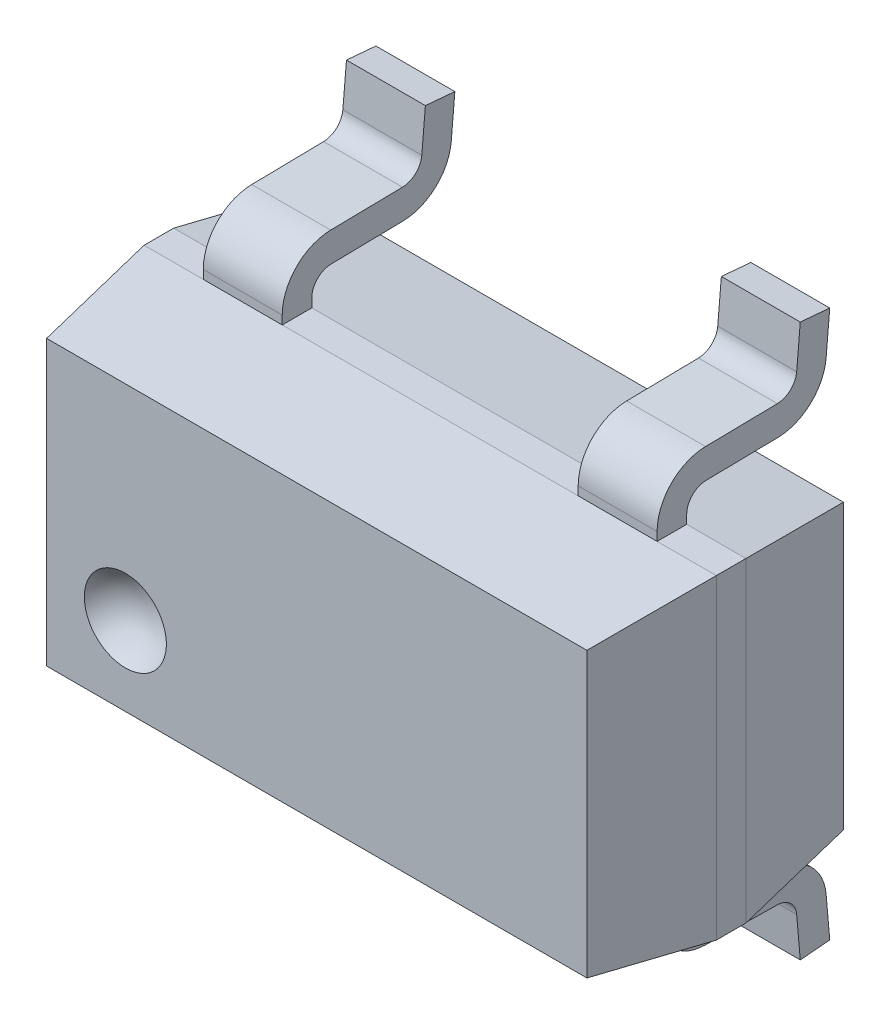
from build123d import *
from OCP.BRepFilletAPI import BRepFilletAPI_MakeChamfer
from build123d.topology import SkipClean

# Parameters (mm, degrees)
BODYWXH_W             = 1.3
BODYWXH_H             = 1.6
BOSS_BODY_DEPTH       = 1.45
CHAMFER1_SIZE         = 0.575
CHAMFER1_SIZE2        = 0.08081098
PINS_DEPTH            = 0.4
PATTERNLEADS_COUNT    = 3
PATTERNLEADS_PITCH    = 0.95
DELETEFACE1_START     = 0.8
DELETEFACE1_OUTLINE_W = 0.4
DELETEFACE1_OUTLINE_H = 1.875
DELETEFACE1_DEPTH     = 0.6


# Read off the part's stored shape, not the designer's step: DeleteFace1
with BuildPart() as part:
    # BodyWxH → Boss-Body (new, symmetric)
    with BuildSketch(Plane(origin=(0, 0, 0), x_dir=(0, 0, -1), z_dir=(1, 0, 0))):
        with Locations((-0.8, 0)):
            Rectangle(BODYWXH_W, BODYWXH_H)
    extrude(amount=BOSS_BODY_DEPTH, both=True)

    # Chamfer1: one chamfer whose edges measure the first distance from different faces: ONE call of the kernel's chamfer builder (chamfer() names one face for all edges)
    chamfer1_edges_1 = [part.edges().sort_by_distance(p)[0] for p in [
        (1.45, 0, 0.15),
        (1.45, 0, 1.45),
    ]]
    chamfer1_side_1 = [part.faces().sort_by_distance(p)[0] for p in [
        (1.45, 0, 0.8),
    ]]
    chamfer1_edges_2 = [part.edges().sort_by_distance(p)[0] for p in [
        (-1.45, 0, 0.15),
        (-1.45, 0, 1.45),
    ]]
    chamfer1_side_2 = [part.faces().sort_by_distance(p)[0] for p in [
        (-1.45, 0, 0.8),
    ]]
    chamfer1_edges_3 = [part.edges().sort_by_distance(p)[0] for p in [
        (0, 0.8, 1.45),
        (0, 0.8, 0.15),
    ]]
    chamfer1_side_3 = [part.faces().sort_by_distance(p)[0] for p in [
        (0, 0.8, 0.8),
    ]]
    chamfer1_edges_4 = [part.edges().sort_by_distance(p)[0] for p in [
        (0, -0.8, 0.15),
        (0, -0.8, 1.45),
    ]]
    chamfer1_side_4 = [part.faces().sort_by_distance(p)[0] for p in [
        (0, -0.8, 0.8),
    ]]
    chamfer1 = BRepFilletAPI_MakeChamfer(part.part.solid().wrapped)
    for e in chamfer1_edges_1:
        chamfer1.Add(CHAMFER1_SIZE, CHAMFER1_SIZE2, e.wrapped, chamfer1_side_1[0].wrapped)  # the first distance lies on this face
    for e in chamfer1_edges_2:
        chamfer1.Add(CHAMFER1_SIZE, CHAMFER1_SIZE2, e.wrapped, chamfer1_side_2[0].wrapped)  # the first distance lies on this face
    for e in chamfer1_edges_3:
        chamfer1.Add(CHAMFER1_SIZE, CHAMFER1_SIZE2, e.wrapped, chamfer1_side_3[0].wrapped)  # the first distance lies on this face
    for e in chamfer1_edges_4:
        chamfer1.Add(CHAMFER1_SIZE, CHAMFER1_SIZE2, e.wrapped, chamfer1_side_4[0].wrapped)  # the first distance lies on this face
    add(Compound.cast(chamfer1.Shape()), mode=Mode.REPLACE)

    # LeadCross → Pins (add)
    with BuildSketch(Plane(origin=(-1.15, 0, 0), x_dir=(0, 0, -1), z_dir=(1, 0, 0))):
        with BuildLine():
            Line((0, -1.386926639), (-0.149429205, -1.4))
            Line((-0.149429205, -1.4), (-0.167692783, -1.19124635))
            ThreePointArc((-0.167692783, -1.19124635), (-0.199112416, -1.126826554), (-0.265567012, -1.099977154))
            Line((-0.265567012, -1.099977154), (-0.629363102, -1.09362707))
            ThreePointArc((-0.629363102, -1.09362707), (-0.803312612, -1.018892462), (-0.875, -0.843665146))
            Line((-0.875, -0.843665146), (-0.875, 0.843665146))
            ThreePointArc((-0.875, 0.843665146), (-0.803312612, 1.018892462), (-0.629363102, 1.09362707))
            Line((-0.629363102, 1.09362707), (-0.265567012, 1.099977154))
            ThreePointArc((-0.265567012, 1.099977154), (-0.199112416, 1.126826554), (-0.167692783, 1.19124635))
            Line((-0.167692783, 1.19124635), (-0.149429205, 1.4))
            Line((-0.149429205, 1.4), (0, 1.386926639))
            Line((0, 1.386926639), (-0.018263578, 1.178172988))
            ThreePointArc((-0.018263578, 1.178172988), (-0.096812662, 1.017123498), (-0.262949151, 0.95))
            Line((-0.262949151, 0.95), (-0.626745241, 0.943649916))
            ThreePointArc((-0.626745241, 0.943649916), (-0.696325045, 0.913756073), (-0.725, 0.843665146))
            Line((-0.725, 0.843665146), (-0.725, -0.843665146))
            ThreePointArc((-0.725, -0.843665146), (-0.696325045, -0.913756073), (-0.626745241, -0.943649916))
            Line((-0.626745241, -0.943649916), (-0.262949151, -0.95))
            ThreePointArc((-0.262949151, -0.95), (-0.096812662, -1.017123498), (-0.018263578, -1.178172988))
            Line((-0.018263578, -1.178172988), (0, -1.386926639))
        make_face()
    pins = extrude(amount=PINS_DEPTH)

    # PatternLeads: Pins ×3
    with Locations(*[(i * PATTERNLEADS_PITCH, 0, 0) for i in range(1, PATTERNLEADS_COUNT)]):
        add(pins)

    # Pin1Indent → Cut-Pin1Indent (revolve, cut)
    with SkipClean():  # the faces are left unmerged after this step: merging them gives an invalid solid
        with BuildSketch(Plane(origin=(-0.97, 0, 0), x_dir=(0, 0, -1), z_dir=(1, 0, 0))):
            with BuildLine():
                Line((-1.57, -0.08), (-1.57, -0.56))
                ThreePointArc((-1.57, -0.56), (-1.33, -0.32), (-1.57, -0.08))
            make_face()
        revolve(axis=Axis((-0.97, -0.08, 1.57), (0, -1, 0)), mode=Mode.SUBTRACT)

    # DeleteFace1 outline → DeleteFace1 (cut)
    with SkipClean():  # the faces are left unmerged after this step: merging them gives an invalid solid
        with BuildSketch(Plane(origin=(0, 0, 0), x_dir=(1, 0, 0), z_dir=(0, 1, 0)).offset(DELETEFACE1_START)):
            with Locations((0, 0.0625)):
                Rectangle(DELETEFACE1_OUTLINE_W, DELETEFACE1_OUTLINE_H)
        extrude(amount=DELETEFACE1_DEPTH, mode=Mode.SUBTRACT)


solid = part.part
